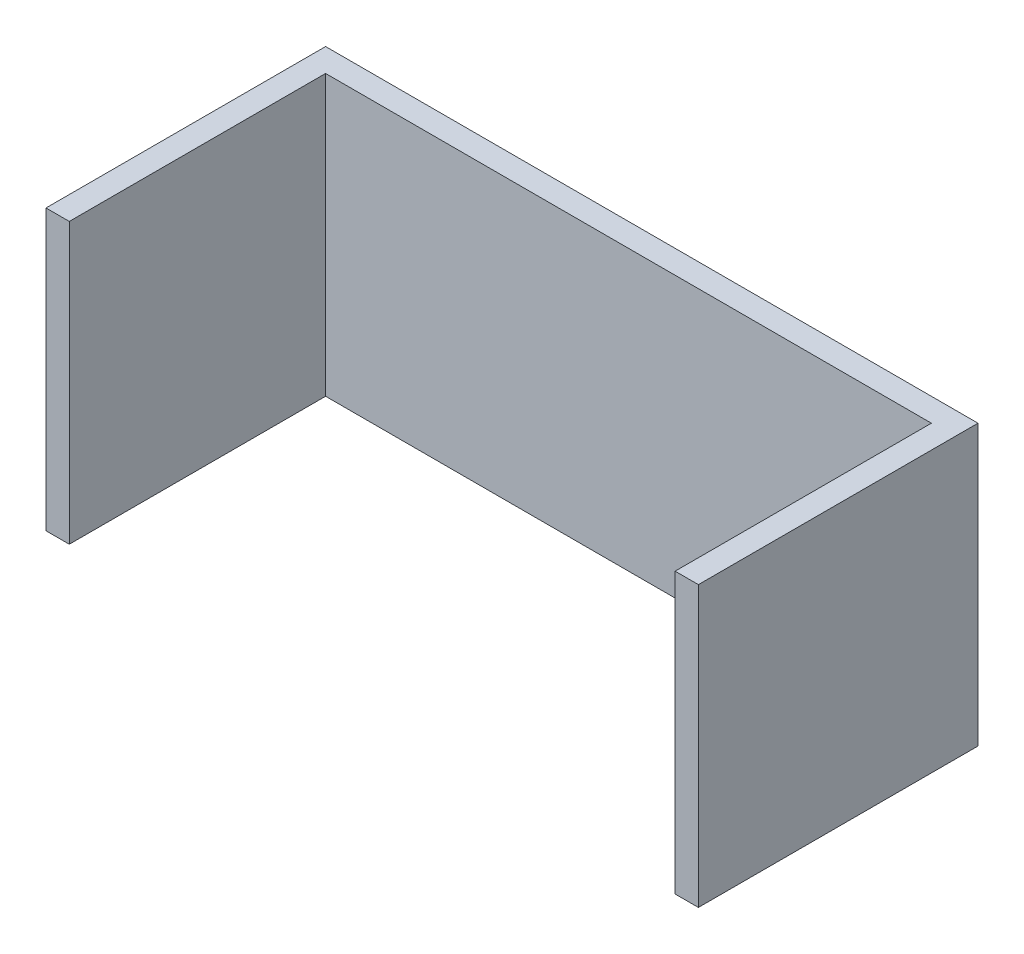
from build123d import *

# Parameters (mm, degrees)
SKETCH1_W           = 177.8
SKETCH1_H           = 76.2
BOSS_EXTRUDE1_DEPTH = 76.2
SKETCH3_W           = 165.1
SKETCH3_H           = 69.85
CUT_EXTRUDE1_DEPTH  = 124.131068378


with BuildPart() as part:
    # Sketch1 → Boss-Extrude1 (new body)
    with BuildSketch(Plane(origin=(0, 0, 0), x_dir=(1, 0, 0), z_dir=(0, 1, 0))):
        Rectangle(SKETCH1_W, SKETCH1_H)
    extrude(amount=BOSS_EXTRUDE1_DEPTH)

    # Sketch3 → Cut-Extrude1 (cut, through all)
    with BuildSketch(Plane(origin=(0, 76.2, 0), x_dir=(1, 0, 0), z_dir=(0, 1, 0))):
        with Locations((0, -3.175)):
            Rectangle(SKETCH3_W, SKETCH3_H)
    extrude(amount=-CUT_EXTRUDE1_DEPTH, mode=Mode.SUBTRACT)


solid = part.part
